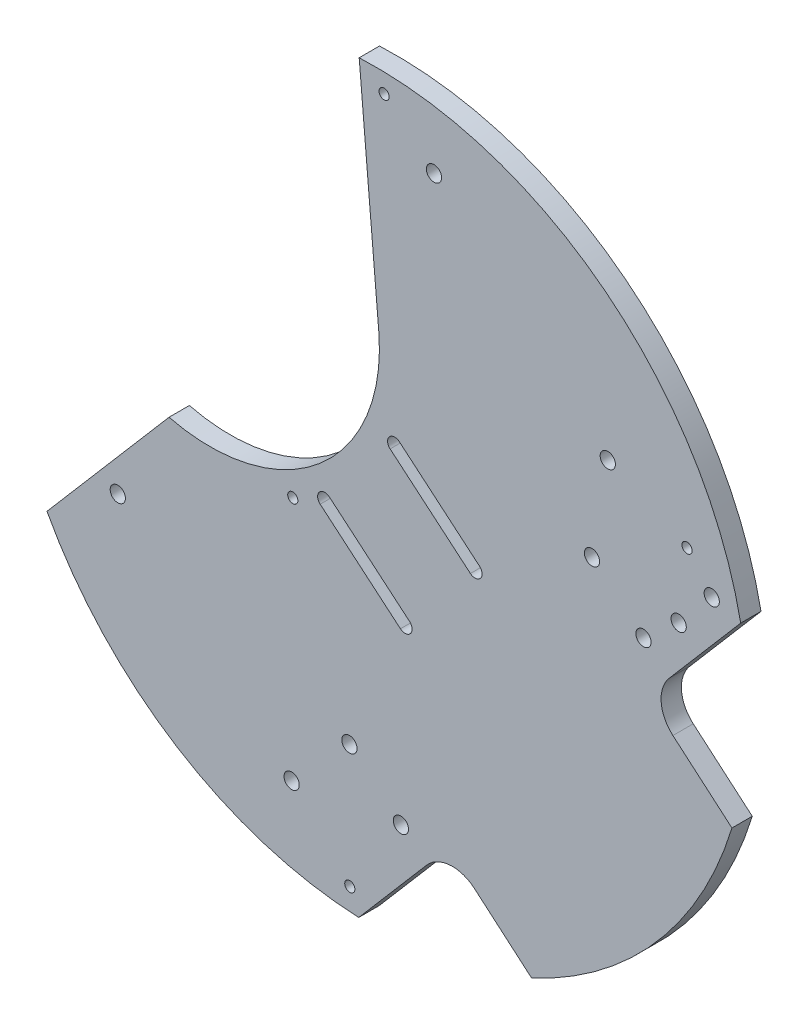
from build123d import *

# Parameters (mm, degrees)
SKETCH1_R                     = 2.25
BOSS_EXTRUDE1_DEPTH           = 6
CUT_EXTRUDE1_DEPTH            = 10
F_4_5_4_5_DIAMETER_HOLE_D     = 4.5
F_4_5_4_5_DIAMETER_HOLE_DEPTH = 10
F_4_5_4_5_DIAMETER_HOLE_TIP   = 1.351936393
F_3_0MM_DOWEL_HOLE1_D         = 3
SKETCH7_R                     = 2.25
CUT_EXTRUDE2_DEPTH            = 10


with BuildPart() as part:
    # Sketch1 → Boss-Extrude1 (new body)
    with BuildSketch(Plane.XY):
        with BuildLine():
            Line((-65.035663921, 1.711915562), (-29.013741643, 43.763540849))
            ThreePointArc((-29.013741643, 43.763540849), (15.528638535, 54.242344342), (32.891210684, 96.578735816))
            Line((32.891210684, 96.578735816), (27.098939814, 163.698257544))
            ThreePointArc((27.098939814, 163.698257544), (127.465162657, -0.583384608), (-65.035663921, 1.711915562))
        make_face()
        with Locations((-44.130722543, 16.588386381)):
            Circle(SKETCH1_R, mode=Mode.SUBTRACT)
        with Locations((7.160790579, -31.047531597)):
            Circle(SKETCH1_R, mode=Mode.SUBTRACT)
        with Locations((100.470270724, 97.551800763)):
            Circle(SKETCH1_R, mode=Mode.SUBTRACT)
        with Locations((49.178757602, 145.187718741)):
            Circle(SKETCH1_R, mode=Mode.SUBTRACT)
    extrude(amount=BOSS_EXTRUDE1_DEPTH)

    # Sketch2 → Cut-Extrude1 (cut)
    with BuildSketch(Plane.XY.offset(6)):
        with BuildLine():
            Line((59.918631336, 48.293162369), (36.232435894, 68.292265986))
            ThreePointArc((36.232435894, 68.292265986), (35.982665158, 71.251592696), (38.941991868, 71.501363433))
            Line((38.941991868, 71.501363433), (62.62818731, 51.502259816))
            ThreePointArc((62.62818731, 51.502259816), (62.877958047, 48.542933105), (59.918631336, 48.293162369))
        make_face()
        with BuildLine():
            Line((39.274395345, 23.842896106), (15.588199903, 43.841999723))
            ThreePointArc((15.588199903, 43.841999723), (15.338429166, 46.801326433), (18.297755877, 47.05109717))
            Line((18.297755877, 47.05109717), (41.983951319, 27.051993553))
            ThreePointArc((41.983951319, 27.051993553), (42.233722055, 24.092666842), (39.274395345, 23.842896106))
        make_face()
    extrude(amount=-CUT_EXTRUDE1_DEPTH, mode=Mode.SUBTRACT)

    # Ø4.5 (4.5) Diameter Hole
    with Locations(Plane(origin=(207.215806152, -96.41995806, 6), x_dir=(-0.6505588840958346, -0.7594558172296677, 0), z_dir=(0, 0, 1))):
        with Locations((80.500098125, -194.461558154), (77.690872648, -264.405165812), (-80.677949684, -277.202176468), (-77.868724207, -207.25856881)):
            Hole(F_4_5_4_5_DIAMETER_HOLE_D / 2, depth=F_4_5_4_5_DIAMETER_HOLE_DEPTH)
            with Locations((0, 0, -(F_4_5_4_5_DIAMETER_HOLE_DEPTH + F_4_5_4_5_DIAMETER_HOLE_TIP / 2))):  # 118° drill point
                Cone(0, F_4_5_4_5_DIAMETER_HOLE_D / 2, F_4_5_4_5_DIAMETER_HOLE_TIP, mode=Mode.SUBTRACT)

    # Ø3.0mm Dowel Hole1 (through all)
    with Locations(Plane(origin=(207.215806152, -96.41995806, 6), x_dir=(-0.6505588840958346, -0.7594558172296677, 0), z_dir=(0, 0, 1))):
        with Locations((-80.915811264, -296.794954316), (-84.945199209, -182.518931257), (25.216324899, -241.36407945), (83.328606401, -169.42446636)):
            Hole(F_3_0MM_DOWEL_HOLE1_D / 2)

    # Sketch7 → Cut-Extrude2 (cut)
    with BuildSketch(Plane.XY.offset(6)):
        with Locations((39.410270698, -26.198883172)):
            Circle(SKETCH7_R)
        with Locations((110.999824953, 57.374033532)):
            Circle(SKETCH7_R)
        with Locations((24.221154353, -13.187705491)):
            Circle(SKETCH7_R)
        with Locations((95.810708608, 70.385211214)):
            Circle(SKETCH7_R)
        with Locations((121.384198104, 66.422365269)):
            Circle(SKETCH7_R)
        with Locations((131.142581365, 77.814202528)):
            Circle(SKETCH7_R)
        with BuildLine():
            Line((139.689194778, 75.494313025), (118.594383125, 50.868444691))
            ThreePointArc((118.594383125, 50.868444691), (116.218631729, 43.592838252), (119.683352457, 36.768297678))
            Line((119.683352457, 36.768297678), (137.105326674, 21.84442739))
            Line((137.105326674, 21.84442739), (157.179168696, 45.278426173))
            Line((157.179168696, 45.278426173), (139.689194778, 75.494313025))
        make_face()
        with BuildLine():
            Line((26.971727927, -56.090910074), (47.00482887, -32.704472013))
            ThreePointArc((47.00482887, -32.704472013), (53.829369443, -29.239751286), (61.104975883, -31.615502682))
            Line((61.104975883, -31.615502682), (77.970944185, -46.063091691))
            Line((77.970944185, -46.063091691), (19.420644617, -114.414115242))
            Line((19.420644617, -114.414115242), (26.971727927, -56.090910074))
        make_face()
    extrude(amount=-CUT_EXTRUDE2_DEPTH, mode=Mode.SUBTRACT)


solid = part.part
